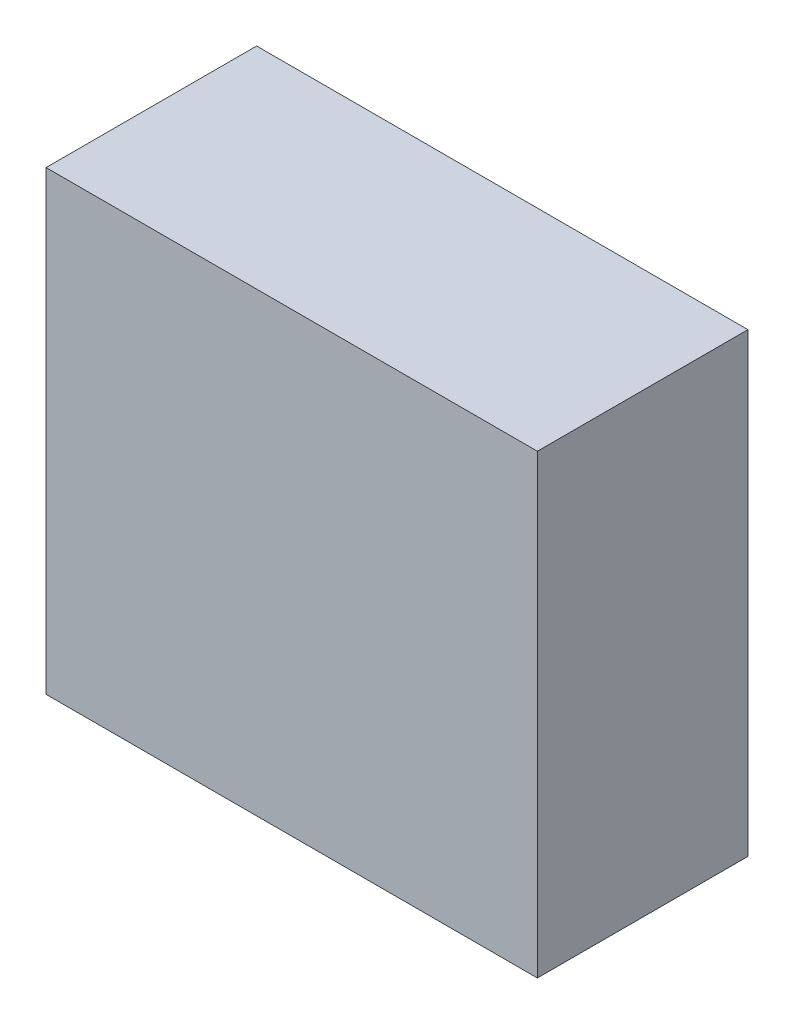
from build123d import *

# Parameters (mm, degrees)
SKETCH1_W           = 177.8
SKETCH1_H           = 76.2
BOSS_EXTRUDE1_DEPTH = 82.55


with BuildPart() as part:
    # Sketch1 → Boss-Extrude1 (new, symmetric)
    with BuildSketch(Plane(origin=(0, 0, 0), x_dir=(1, 0, 0), z_dir=(0, 1, 0))):
        Rectangle(SKETCH1_W, SKETCH1_H)
    extrude(amount=BOSS_EXTRUDE1_DEPTH, both=True)


solid = part.part
